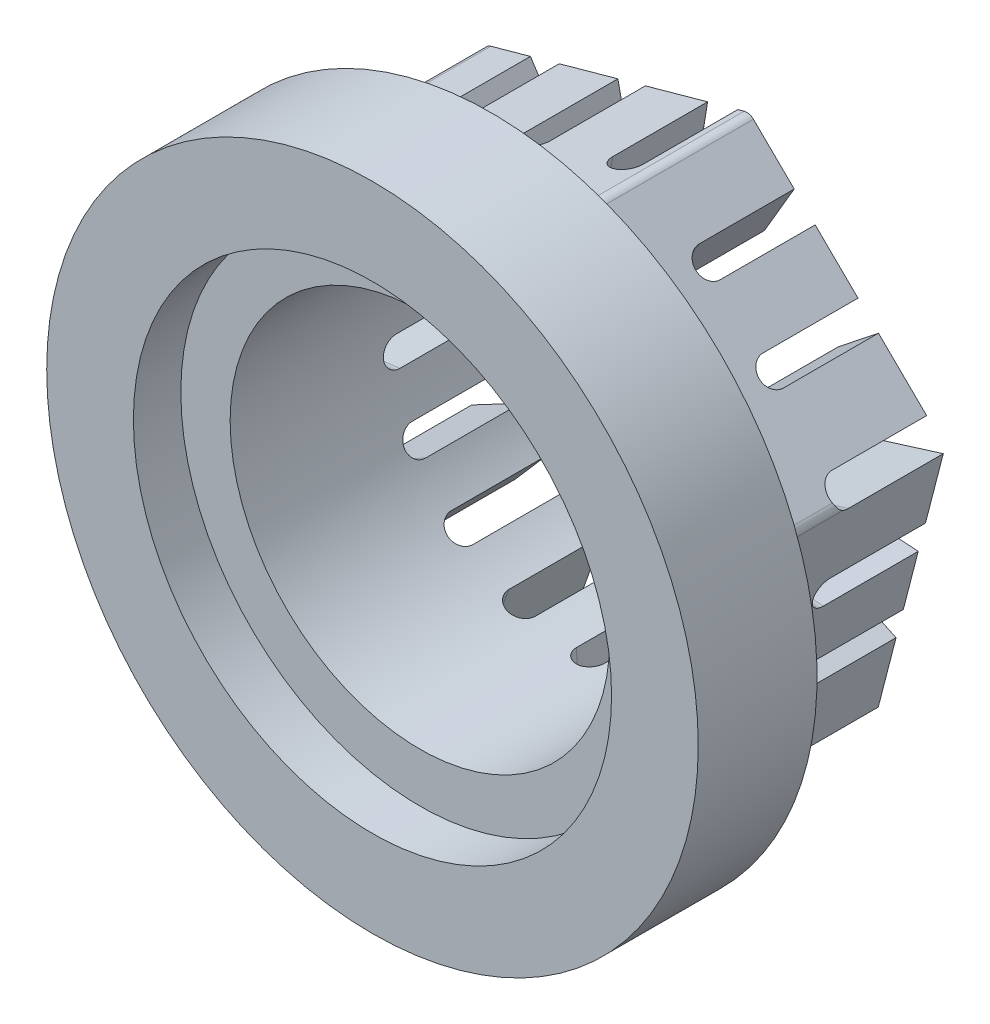
from build123d import *

# Parameters (mm, degrees)
SKETCH1_R           = 21.79955
BOSS_EXTRUDE1_DEPTH = 20.6502
SKETCH2_R           = 12.7
CUT_EXTRUDE1_DEPTH  = 20.6502
SKETCH3_R           = 16.000000004
CUT_EXTRUDE2_DEPTH  = 3.175
SKETCH4_OUTSIDE_W   = 58.604
SKETCH4_OUTSIDE_H   = 58.604
CUT_EXTRUDE3_DEPTH  = 12.7
CUT_EXTRUDE4_DEPTH  = 9.8552
CIRPATTERN1_COUNT   = 17
FILLET1_R           = 0.635


with BuildPart() as part:
    # Sketch1 → Boss-Extrude1 (new body)
    with BuildSketch(Plane.XY):
        Circle(SKETCH1_R)
    extrude(amount=BOSS_EXTRUDE1_DEPTH)

    # Sketch2 → Cut-Extrude1 (cut)
    with BuildSketch(Plane.XY.offset(20.6502)):
        Circle(SKETCH2_R)
    extrude(amount=-CUT_EXTRUDE1_DEPTH, mode=Mode.SUBTRACT)

    # Sketch3 → Cut-Extrude2 (cut)
    with BuildSketch(Plane.XY.offset(20.6502)):
        Circle(SKETCH3_R)
    extrude(amount=-CUT_EXTRUDE2_DEPTH, mode=Mode.SUBTRACT)

    # Sketch4 outside → Cut-Extrude3 (cut)
    with BuildSketch(Plane(origin=(0, 0, 0), x_dir=(-1, 0, 0), z_dir=(0, 0, -1))):
        Rectangle(SKETCH4_OUTSIDE_W, SKETCH4_OUTSIDE_H)
        Polygon((17.661795398, -4.907322758), (13.080763872, 12.841902112), (-4.581031526, 17.74922487), (-17.661795398, 4.907322758), (-13.080763872, -12.841902112), (4.581031526, -17.74922487), align=None, mode=Mode.SUBTRACT)
    extrude(amount=-CUT_EXTRUDE3_DEPTH, mode=Mode.SUBTRACT)

    # Sketch5 → Cut-Extrude4 (cut, symmetric)
    with BuildSketch(Plane(origin=(-15.371279635, 3.967289677, 0), x_dir=(0, 0, 1), z_dir=(-0.9682695833030739, 0.24990801117629627, 0))):
        with BuildLine():
            Line((6.35, 0.9525), (0, 0.9525))
            Line((0, 0.9525), (0, -0.9525))
            Line((0, -0.9525), (6.35, -0.9525))
            ThreePointArc((6.35, -0.9525), (7.3025, 0), (6.35, 0.9525))
        make_face()
    cut_extrude4 = extrude(amount=CUT_EXTRUDE4_DEPTH, both=True, mode=Mode.SUBTRACT)

    # CirPattern1: Cut-Extrude4 ×17 about axis
    cirpattern1_axis = Axis((0, 0, 17.4752), (0, 0, 1))
    for i in range(1, CIRPATTERN1_COUNT):
        add(cut_extrude4.rotate(cirpattern1_axis, i * 360 / CIRPATTERN1_COUNT), mode=Mode.SUBTRACT)

    # Fillet1
    fillet1_edges = [part.edges().sort_by_distance(p)[0] for p in [
        (-17.661795398, -4.907322758, 6.35),
        (-13.080763872, 12.841902112, 6.35),
        (4.581031526, 17.74922487, 6.35),
        (17.661795398, 4.907322758, 9.908599961),
        (13.080763872, -12.841902112, 9.908599961),
        (-4.581031526, -17.74922487, 6.35),
    ]]
    fillet(fillet1_edges, radius=FILLET1_R)


solid = part.part
